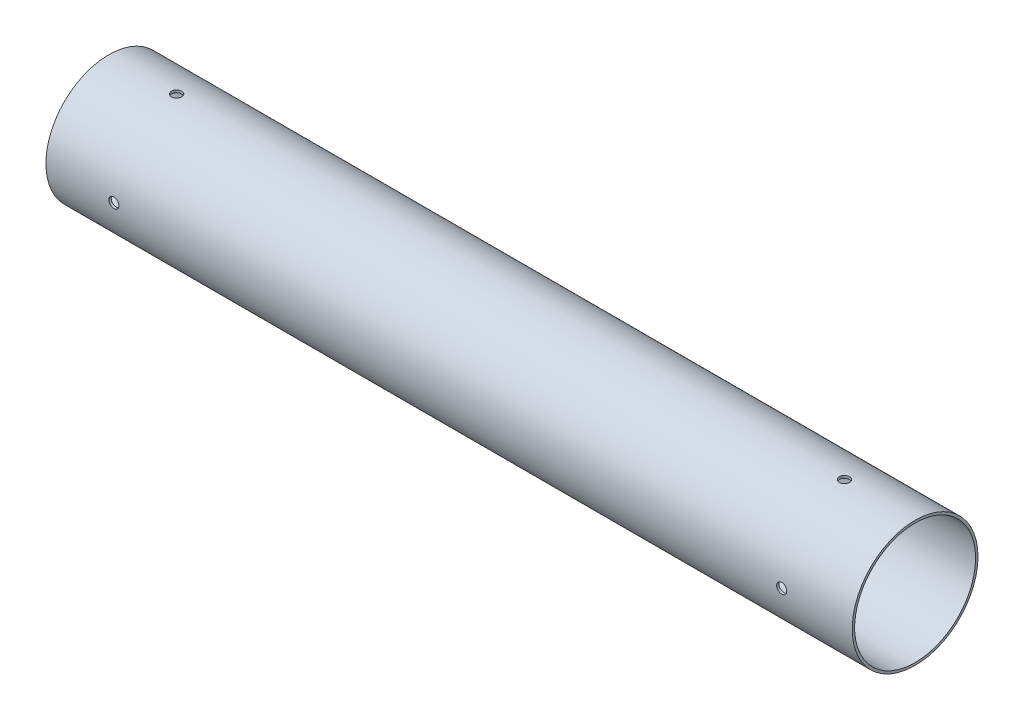
from build123d import *

# Parameters (mm, degrees)
SKETCH1_R           = 39.624
SKETCH1_R_2         = 38.1
BOSS_EXTRUDE1_DEPTH = 508
SKETCH2_R           = 3.175
CUT_EXTRUDE1_DEPTH  = 512.081326945
CIRPATTERN1_COUNT   = 4
SKETCH3_R           = 3.175
CUT_EXTRUDE2_DEPTH  = 512.08132706
CIRPATTERN2_COUNT   = 4


with BuildPart() as part:
    # Sketch1 → Boss-Extrude1 (new body)
    with BuildSketch(Plane.YZ):
        Circle(SKETCH1_R)
        Circle(SKETCH1_R_2, mode=Mode.SUBTRACT)
    extrude(amount=BOSS_EXTRUDE1_DEPTH)

    # Sketch2 → Cut-Extrude1 (cut, through all)
    with BuildSketch(Plane(origin=(0, 0, 0), x_dir=(-1, 0, 0), z_dir=(0, 1, 0))):
        with Locations((-42.8244, 0)):
            Circle(SKETCH2_R)
    cut_extrude1 = extrude(amount=CUT_EXTRUDE1_DEPTH, mode=Mode.SUBTRACT)

    # CirPattern1: Cut-Extrude1 ×4 about axis
    cirpattern1_axis = Axis((508, 0, 0), (-1, 0, 0))
    for i in range(1, CIRPATTERN1_COUNT):
        add(cut_extrude1.rotate(cirpattern1_axis, i * 360 / CIRPATTERN1_COUNT), mode=Mode.SUBTRACT)

    # Sketch3 → Cut-Extrude2 (cut, through all)
    with BuildSketch(Plane(origin=(0, 0, 0), x_dir=(-1, 0, 0), z_dir=(0, 1, 0))):
        with Locations((-463.55, 0)):
            Circle(SKETCH3_R)
    cut_extrude2 = extrude(amount=CUT_EXTRUDE2_DEPTH, mode=Mode.SUBTRACT)

    # CirPattern2: Cut-Extrude2 ×4 about axis
    cirpattern2_axis = Axis((508, 0, 0), (-1, 0, 0))
    for i in range(1, CIRPATTERN2_COUNT):
        add(cut_extrude2.rotate(cirpattern2_axis, i * 360 / CIRPATTERN2_COUNT), mode=Mode.SUBTRACT)


solid = part.part
